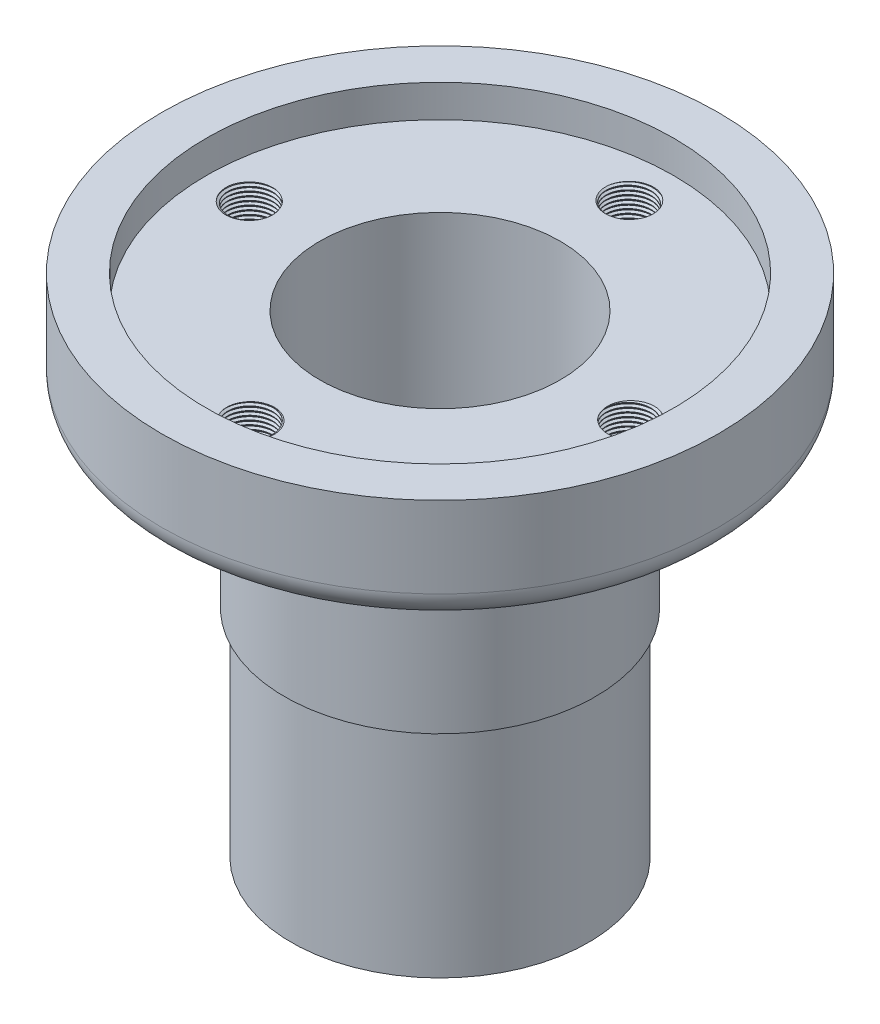
from build123d import *

# Parameters (mm, degrees)
CIRPATTERN1_COUNT = 4
THREAD1_PITCH     = 1.5
CIRPATTERN2_COUNT = 4


with BuildPart() as part:
    # Sketch1 → Revolve2 (revolve)
    with BuildSketch(Plane.XY, mode=Mode.PRIVATE) as revolve2_sk:
        with BuildLine():
            Line((40.5, 0), (55, 0))
            Line((55, 0), (55, 80))
            Line((55, 80), (57.5, 80))
            Line((57.5, 80), (57.5, 127))
            ThreePointArc((57.5, 127), (63.357864376, 141.142135624), (77.5, 147))
            Line((77.5, 147), (93, 147))
            ThreePointArc((93, 147), (100.071067812, 149.928932188), (103, 157))
            Line((103, 157), (103, 187))
            Line((103, 187), (86.508091045, 187))
            Line((86.508091045, 187), (86.508091045, 175))
            Line((86.508091045, 175), (44.5, 175))
            Line((44.5, 175), (44.5, 103))
            Line((44.5, 103), (36, 103))
            Line((36, 103), (36, 59))
            Line((36, 59), (40.5, 59))
            Line((40.5, 59), (40.5, 0))
        make_face()
    revolve(revolve2_sk.sketch.rotate(Axis((0, 0, 0), (0, 1, 0)), 90), axis=Axis((0, 0, 0), (0, 1, 0)))

    # Sketch3 → Ø1.0mm Dowel Hole1 (revolve, cut)
    with BuildSketch(Plane(origin=(0, 175, -70), x_dir=(0, 0, 1), z_dir=(1, 0, 0))):
        Polygon((0, 0), (0, 19.957100107), (8.25, 15), (8.25, 0), align=None)
    f_1_0mm_dowel_hole1 = revolve(axis=Axis((0, 181.35, -70), (0, -1, 0)), mode=Mode.SUBTRACT)

    # CirPattern1: Ø1.0mm Dowel Hole1 ×4 about axis
    cirpattern1_axis = Axis((0, 0, 0), (0, 1, 0))
    for i in range(1, CIRPATTERN1_COUNT):
        add(f_1_0mm_dowel_hole1.rotate(cirpattern1_axis, i * 360 / CIRPATTERN1_COUNT), mode=Mode.SUBTRACT)

    # Thread1: the profile of Thread Profile1 profile screwed along a right-hand helix of 13.333333 turns, 8 arcs to a turn; built about Z, then put on its axis
    thread1_z = Axis((0, 0, 0), (0, 0, 1))
    thread1_corners = [(8.2497, 0, -0.000173205), (8.2497, 0, 1.312673201), (9.061898813, 0, 0.843749998), (9.061898813, 0, 0.468749998)]
    with BuildLine(mode=Mode.PRIVATE) as thread1_profile:
        Line(thread1_corners[0], thread1_corners[1])
        Line(thread1_corners[1], thread1_corners[2])
        Line(thread1_corners[2], thread1_corners[3])
        Line(thread1_corners[3], thread1_corners[0])
    thread1_cap = Face(thread1_profile.wire())
    thread1_turn_angles = [0, 22.5, 45, 67.5, 90, 112.5, 135, 157.5, 180, 202.5, 225, 247.5, 270, 292.5, 315, 337.5, 360]
    thread1_turn_weights = [1, 0.9238795325112867, 1, 0.9238795325112867, 1, 0.9238795325112867, 1, 0.9238795325112867, 1, 0.9238795325112867, 1, 0.9238795325112867, 1, 0.9238795325112867, 1, 0.9238795325112867, 1]
    thread1_turn_rails = [Edge.make_bspline([Vector(p[0], p[1], 0).rotate(thread1_z, thread1_turn_angles[k]) / thread1_turn_weights[k] + Vector(0, 0, p[2] + THREAD1_PITCH * thread1_turn_angles[k] / 360) for k in range(17)], [0, 0, 0, 1, 1, 2, 2, 3, 3, 4, 4, 5, 5, 6, 6, 7, 7, 8, 8, 8], 2, thread1_turn_weights) for p in thread1_corners]
    thread1_turn_sides = [Face.make_surface_from_curves(thread1_turn_rails[p[0]], thread1_turn_rails[p[1]]) for p in [(0, 1), (1, 2), (2, 3), (3, 0)]]
    thread1_last_angles = [4680, 4702.5, 4725, 4747.5, 4770, 4785, 4800]
    thread1_last_weights = [1, 0.9238795325112867, 1, 0.9238795325112867, 1, 0.9659258262890703, 1]
    thread1_last_rails = [Edge.make_bspline([Vector(p[0], p[1], 0).rotate(thread1_z, thread1_last_angles[k]) / thread1_last_weights[k] + Vector(0, 0, p[2] + THREAD1_PITCH * thread1_last_angles[k] / 360) for k in range(7)], [0, 0, 0, 1, 1, 2, 2, 3, 3, 3], 2, thread1_last_weights) for p in thread1_corners]
    thread1_last_sides = [Face.make_surface_from_curves(thread1_last_rails[p[0]], thread1_last_rails[p[1]]) for p in [(0, 1), (1, 2), (2, 3), (3, 0)]]
    thread1 = Plane(origin=(-70, 180, 0), x_dir=(-1, 0, 0), z_dir=(0, -1, 0)) * Solid(Shell([*[p.moved(Location((0, 0, THREAD1_PITCH * i))) for i in range(13) for p in thread1_turn_sides], *thread1_last_sides, thread1_cap, thread1_cap.rotate(thread1_z, 4800).moved(Location((0, 0, THREAD1_PITCH * 4800 / 360)))]))
    add(thread1, mode=Mode.SUBTRACT)

    # CirPattern2: Thread1 ×4 about axis
    cirpattern2_axis = Axis((0, 187, 0), (0, -1, 0))
    for i in range(1, CIRPATTERN2_COUNT):
        add(thread1.rotate(cirpattern2_axis, i * 360 / CIRPATTERN2_COUNT), mode=Mode.SUBTRACT)


solid = part.part
